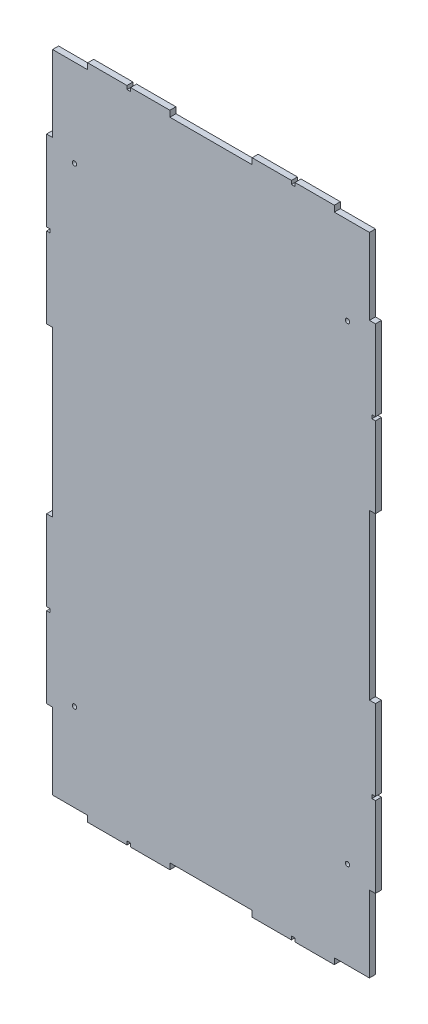
from build123d import *

# Parameters (mm, degrees)
BOSS_EXTRUDE1_DEPTH     = 5.5
CUT_EXTRUDE1_DEPTH      = 664.465030112
CUT_EXTRUDE1_DEPTH_BACK = 664.465030112
SKETCH2_R               = 2


with BuildPart() as part:
    # Sketch1 → Boss-Extrude1 (new body)
    with BuildSketch(Plane.XY):
        Polygon((-0.002685186, 588.997205838), (-0.002685186, 519.497205838), (-5.502685186, 519.497205838), (-5.502685186, 446.122205838), (-2.252685186, 446.122205838), (-2.252685186, 444.497205838), (-2.252685186, 442.872205838), (-5.502685186, 442.872205838), (-5.502685186, 369.497205838), (-0.002685186, 369.497205838), (-0.002685186, 219.497205838), (-5.502685186, 219.497205838), (-5.502685186, 146.122205838), (-2.252685186, 146.122205838), (-2.252685186, 144.497205838), (-2.252685186, 142.872205838), (-5.502685186, 142.872205838), (-5.502685186, 69.497205838), (-0.002685186, 69.497205838), (-0.002685186, -0.002794162), (31.997314814, -0.002794162), (31.997314814, -5.502794162), (67.872314814, -5.502794162), (67.872314814, -2.252794162), (69.497314814, -2.252794162), (71.122314814, -2.252794162), (71.122314814, -5.502794162), (106.997314814, -5.502794162), (106.997314814, -0.002794162), (181.997314814, -0.002794162), (181.997314814, -5.502794162), (217.872314814, -5.502794162), (217.872314814, -2.252794162), (219.497314814, -2.252794162), (221.122314814, -2.252794162), (221.122314814, -5.502794162), (256.997314814, -5.502794162), (256.997314814, -0.002794162), (288.997314814, -0.002794162), (288.997314814, 69.497205838), (294.497314814, 69.497205838), (294.497314814, 142.872205838), (291.247314814, 142.872205838), (291.247314814, 144.497205838), (291.247314814, 146.122205838), (294.497314814, 146.122205838), (294.497314814, 219.497205838), (288.997314814, 219.497205838), (288.997314814, 369.497205838), (294.497314814, 369.497205838), (294.497314814, 442.872205838), (291.247314814, 442.872205838), (291.247314814, 444.497205838), (291.247314814, 446.122205838), (294.497314814, 446.122205838), (294.497314814, 519.497205838), (288.997314814, 519.497205838), (288.997314814, 588.997205838), (256.997314814, 588.997205838), (256.997314814, 594.497205838), (221.122314814, 594.497205838), (221.122314814, 591.247205838), (219.497314814, 591.247205838), (217.872314814, 591.247205838), (217.872314814, 594.497205838), (181.997314814, 594.497205838), (181.997314814, 588.997205838), (106.997314814, 588.997205838), (106.997314814, 594.497205838), (71.122314814, 594.497205838), (71.122314814, 591.247205838), (69.497314814, 591.247205838), (67.872314814, 591.247205838), (67.872314814, 594.497205838), (31.997314814, 594.497205838), (31.997314814, 588.997205838), align=None)
    extrude(amount=BOSS_EXTRUDE1_DEPTH)

    # Sketch2 → Cut-Extrude1 (cut, two sides: drawn at the far end of the back side and taken through both)
    with BuildSketch(Plane.XY.offset(-CUT_EXTRUDE1_DEPTH_BACK)):
        with Locations((19.997314814, 508.997205838)):
            Circle(SKETCH2_R)
        with Locations((268.997314814, 508.997205838)):
            Circle(SKETCH2_R)
        with Locations((19.997314814, 79.997205838)):
            Circle(SKETCH2_R)
        with Locations((268.997314814, 79.997205838)):
            Circle(SKETCH2_R)
    extrude(amount=CUT_EXTRUDE1_DEPTH + CUT_EXTRUDE1_DEPTH_BACK, mode=Mode.SUBTRACT)


solid = part.part
